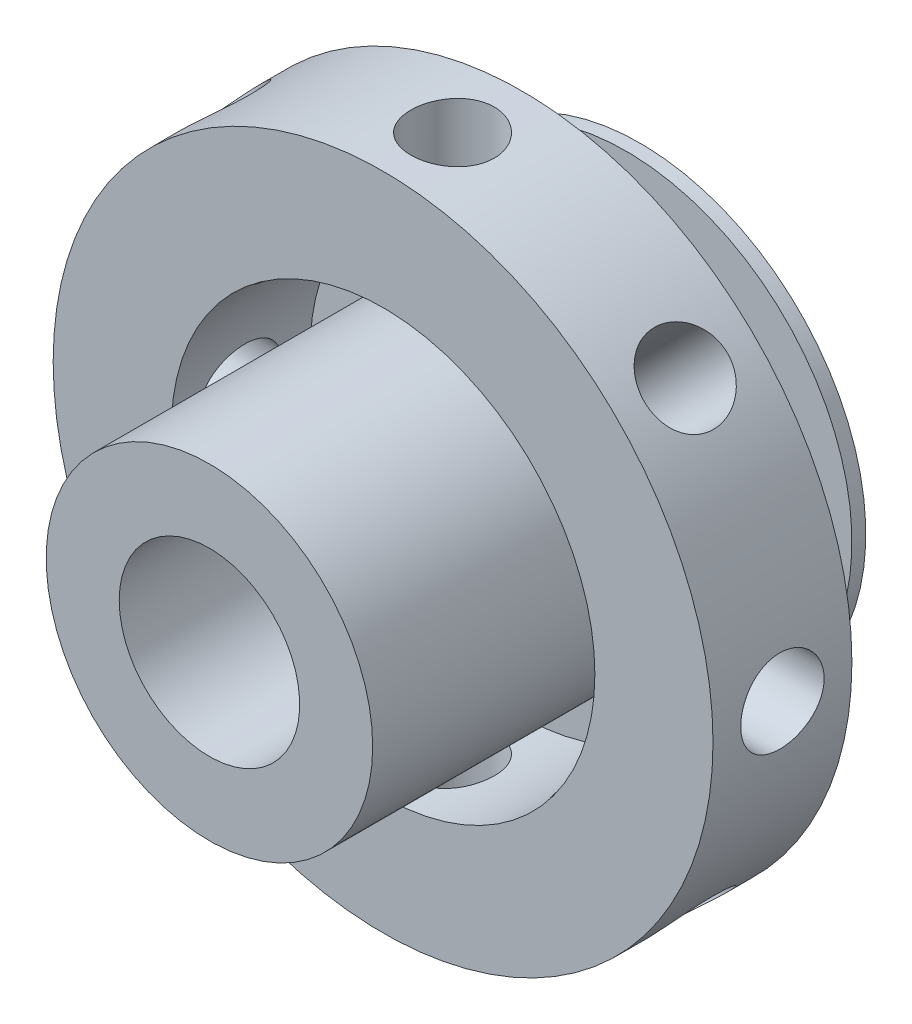
from build123d import *

# Parameters (mm, degrees)
CROQUIS2_R              = 5.97
SALIENTE_EXTRUIR1_DEPTH = 10.16
CROQUIS3_R              = 12.065
SALIENTE_EXTRUIR2_DEPTH = 5.08
CROQUIS5_R              = 7.745
CROQUIS5_R_2            = 5.97
CORTAR_EXTRUIR1_DEPTH   = 5.08
CROQUIS6_R              = 9.525
SALIENTE_EXTRUIR3_DEPTH = 1.27
REDONDEO1_R             = 1.27
CROQUIS7_R              = 4.445
SALIENTE_EXTRUIR4_DEPTH = 2.54
CROQUIS8_R              = 8.255
SALIENTE_EXTRUIR5_DEPTH = 1.27
CHAFL_N1_SIZE           = 0.762
CHAFL_N1_SIZE2          = 2.213008689
CROQUIS9_R              = 3.3
CORTAR_EXTRUIR2_DEPTH   = 19.05
CROQUIS10_R             = 1.525
CORTAR_EXTRUIR3_DEPTH   = 5.08
MATRIZC1_COUNT          = 8
CROQUIS11_R             = 5.97
CROQUIS11_R_2           = 3.3
SALIENTE_EXTRUIR6_DEPTH = 1.27


with BuildPart() as part:
    # Croquis2 → Saliente-Extruir1 (new body)
    with BuildSketch(Plane.XY):
        Circle(CROQUIS2_R)
    extrude(amount=-SALIENTE_EXTRUIR1_DEPTH)

    # Croquis3 → Saliente-Extruir2 (add)
    with BuildSketch(Plane(origin=(0, 0, -10.16), x_dir=(-1, 0, 0), z_dir=(0, 0, -1))):
        Circle(CROQUIS3_R)
    extrude(amount=-SALIENTE_EXTRUIR2_DEPTH)

    # Croquis5 → Cortar-Extruir1 (cut)
    with BuildSketch(Plane.XY.offset(-5.08)):
        Circle(CROQUIS5_R)
        Circle(CROQUIS5_R_2, mode=Mode.SUBTRACT)
    extrude(amount=-CORTAR_EXTRUIR1_DEPTH, mode=Mode.SUBTRACT)


with BuildPart() as cortar_extruir1_piece_1:
    # of the separate pieces the step leaves, piece 1, a body of its own (cortar_extruir1_pieces)
    add(part.part.solids().sort_by_distance((-12.065, 0, -5.08))[0])



with BuildPart() as cortar_extruir1_piece_2:
    # of the separate pieces the step leaves, piece 2, a body of its own (cortar_extruir1_pieces)
    add(part.part.solids().sort_by_distance((5.97, 0, 0))[0])


with BuildPart() as cortar_extruir1_piece_1_1:
    add(cortar_extruir1_piece_1.part)

    add(cortar_extruir1_piece_2.part)  # Saliente-Extruir3 merges Cortar-Extruir1 piece 2
    # Croquis6 → Saliente-Extruir3 (add)
    with BuildSketch(Plane(origin=(0, 0, -10.16), x_dir=(-1, 0, 0), z_dir=(0, 0, -1))):
        with Locations(Location((0, 0, 0), (0, 0, 180))):
            Circle(CROQUIS6_R)
    extrude(amount=SALIENTE_EXTRUIR3_DEPTH)

    # Redondeo1
    redondeo1_edges = [cortar_extruir1_piece_1_1.edges().sort_by_distance(p)[0] for p in [
        (-9.525, 0, -10.16),
    ]]
    fillet(redondeo1_edges, radius=REDONDEO1_R - 0.0001)  # a hair under: the kernel refuses the full size

    # Croquis7 → Saliente-Extruir4 (add)
    with BuildSketch(Plane(origin=(0, 0, -11.43), x_dir=(-1, 0, 0), z_dir=(0, 0, -1))):
        Circle(CROQUIS7_R)
    extrude(amount=SALIENTE_EXTRUIR4_DEPTH)

    # Croquis8 → Saliente-Extruir5 (add)
    with BuildSketch(Plane(origin=(0, 0, -13.97), x_dir=(-1, 0, 0), z_dir=(0, 0, -1))):
        Circle(CROQUIS8_R)
    extrude(amount=SALIENTE_EXTRUIR5_DEPTH)

    # Chaflán1
    chafl_n1_edges = [cortar_extruir1_piece_1_1.edges().sort_by_distance(p)[0] for p in [
        (8.255, 0, -15.24),
    ]]
    chafl_n1_side = [cortar_extruir1_piece_1_1.faces().sort_by_distance(p)[0] for p in [
        (8.255, 0, -14.605),
    ]]
    chamfer(chafl_n1_edges, length=CHAFL_N1_SIZE, length2=CHAFL_N1_SIZE2, reference=chafl_n1_side[0])

    # Croquis9 → Cortar-Extruir2 (cut)
    with BuildSketch(Plane(origin=(0, 0, -15.24), x_dir=(-1, 0, 0), z_dir=(0, 0, -1))):
        Circle(CROQUIS9_R)
    extrude(amount=-CORTAR_EXTRUIR2_DEPTH, mode=Mode.SUBTRACT)

    # Croquis10 → Cortar-Extruir3 (cut)
    with BuildSketch(Plane(origin=(0, 12.065, 0), x_dir=(1, 0, 0), z_dir=(0, 1, 0))):
        with Locations(Location((0, 7.62, 0), (0, 0, 270))):
            Circle(CROQUIS10_R)
    cortar_extruir3 = extrude(amount=-CORTAR_EXTRUIR3_DEPTH, mode=Mode.SUBTRACT)

    # MatrizC1: Cortar-Extruir3 ×8 about axis
    matrizc1_axis = Axis((0, 0, -10.16), (0, 0, 1))
    for i in range(1, MATRIZC1_COUNT):
        add(cortar_extruir3.rotate(matrizc1_axis, i * 360 / MATRIZC1_COUNT), mode=Mode.SUBTRACT)

    # Croquis11 → Saliente-Extruir6 (add)
    with BuildSketch(Plane.XY):
        Circle(CROQUIS11_R)
        with Locations(Location((0, 0, 0), (0, 0, 180))):
            Circle(CROQUIS11_R_2, mode=Mode.SUBTRACT)
    extrude(amount=SALIENTE_EXTRUIR6_DEPTH)


solid = cortar_extruir1_piece_1_1.part
